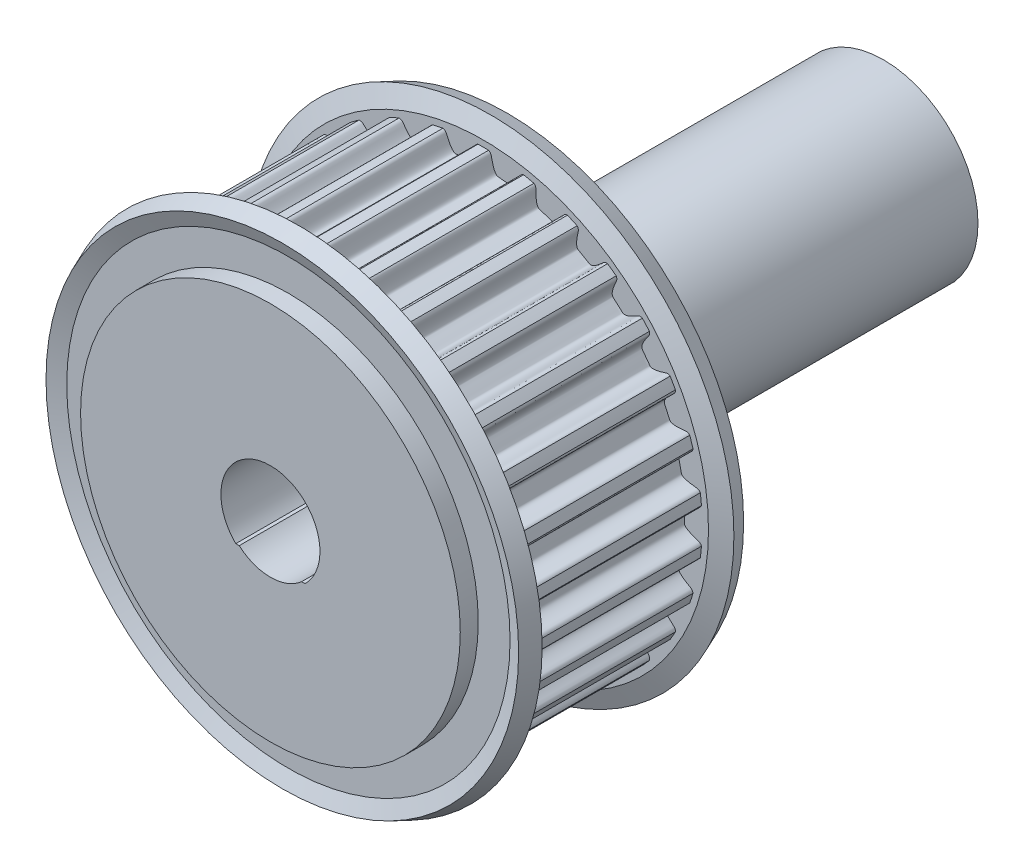
from build123d import *

# Parameters (mm, degrees)
TOOTHEXTRUDECUTGEARBELT01_DEPTH = 3.749999944
TOOTH_PATTERN_30_COUNT          = 30
BOREREVOLVESKETCH_W             = 10.547999842
BOREREVOLVESKETCH_H             = 5
SKETCH_5_R                      = 5
EXTRUDE_1_DEPTH                 = 11
SKETCH_6_R                      = 4
SKETCH_6_R_2                    = 2
EXTRUDE_2_DEPTH                 = 15
CUT_EXTRUDE_4_DEPTH             = 30.810160485
EXTRUDE_START                   = 15
EXTRUDE_4_DEPTH                 = 15
SKETCH_11_R                     = 2
CUT_EXTRUDE_5_DEPTH             = 21.919982509


with BuildPart() as part:
    # SketchRevolveGearBelt01 → Gates_PowerGrip_GT_2mm, 6mm Belt Width (revolve)
    with BuildSketch(Plane(origin=(0, 0, 0), x_dir=(0, 0, -1), z_dir=(1, 0, 0))):
        Polygon((5.273999921, 0), (5.273999921, 8.049296465), (4.511999932, 8.049296465), (4.511999932, 9.39772522), (4.769626867, 10.01969166), (4.065630673, 10.311296431), (3.749999944, 9.549296442), (3.749999944, 9.280480626), (-3.749999944, 9.280480626), (-3.749999944, 9.549296442), (-4.065630673, 10.311296431), (-4.769626867, 10.01969166), (-4.511999932, 9.39772522), (-4.511999932, 8.049296465), (-5.273999921, 8.049296465), (-5.273999921, 0), align=None)
    revolve(axis=Axis((0, 0, 0), (0, 0, -1)))

    # SketchToothGearBelt01 → ToothExtrudeCutGearBelt01 (cut, symmetric)
    with BuildSketch(Plane.XY):
        with BuildLine():
            ThreePointArc((9.259469869, 0.812097889), (9.295013999, 0), (9.259469869, -0.812097889))
            add(Edge.make_bspline(
                [(9.259469869, -0.812097889), (9.259882643, -0.798926426), (9.258535745, -0.779109129), (9.252881928, -0.753334284), (9.246755053, -0.734515852), (9.238801169, -0.716393821), (9.229098, -0.699145002), (9.217740163, -0.682937939), (9.204838756, -0.667930081), (9.190518793, -0.65427062), (9.174923394, -0.642082736), (9.158192233, -0.631523205), (9.140535394, -0.622553924), (9.096806178, -0.606636992), (9.040654354, -0.589254035), (8.974000339, -0.567478509), (8.923234955, -0.549822047), (8.875536871, -0.532182767), (8.830912224, -0.514541632), (8.789358436, -0.496903406), (8.750874778, -0.479266882), (8.715459684, -0.46163211), (8.68311132, -0.443998471), (8.653827322, -0.426364888), (8.627604868, -0.408729361), (8.604440496, -0.39108843), (8.584331378, -0.373436343), (8.567273563, -0.355764081), (8.553273739, -0.338058507), (8.542322401, -0.320303478), (8.534501566, -0.302483729), (8.529637264, -0.284599108), (8.527464323, -0.250294946), (8.531227193, -0.199977901), (8.531655597, -0.133284358), (8.532656984, -0.066646885), (8.532835685, 0), (8.532656984, 0.066646885), (8.531655597, 0.133284358), (8.531227193, 0.199977901), (8.527464323, 0.250294946), (8.529637264, 0.284599108), (8.534501566, 0.302483729), (8.542322401, 0.320303478), (8.553273739, 0.338058507), (8.567273563, 0.355764081), (8.584331378, 0.373436343), (8.604440496, 0.39108843), (8.627604868, 0.408729361), (8.653827322, 0.426364888), (8.68311132, 0.443998471), (8.715459684, 0.46163211), (8.750874778, 0.479266882), (8.789358436, 0.496903406), (8.830912224, 0.514541632), (8.875536871, 0.532182767), (8.923234955, 0.549822047), (8.974000339, 0.567478509), (9.040654354, 0.589254035), (9.096806178, 0.606636992), (9.140535394, 0.622553924), (9.158192233, 0.631523205), (9.174923394, 0.642082736), (9.190518793, 0.65427062), (9.204838756, 0.667930081), (9.217740163, 0.682937939), (9.229098, 0.699145002), (9.238801169, 0.716393821), (9.246755053, 0.734515852), (9.252881928, 0.753334284), (9.258535745, 0.779109129), (9.259882643, 0.798926426), (9.259469869, 0.812097889)],
                knots=[0, 0, 0, 0, 0.015923832, 0.023885748, 0.031847664, 0.039809581, 0.047771497, 0.055733413, 0.063695329, 0.071657245, 0.079619161, 0.087581077, 0.095542993, 0.10350491, 0.143783134, 0.166612007, 0.18826668, 0.208754844, 0.228085578, 0.246269698, 0.263320202, 0.279252862, 0.294087016, 0.307846634, 0.320561765, 0.332270503, 0.343021643, 0.352878214, 0.361921967, 0.370258601, 0.378022746, 0.385380527, 0.392526466, 0.419432991, 0.44628866, 0.47314433, 0.5, 0.52685567, 0.55371134, 0.580567009, 0.607473534, 0.614619473, 0.621977254, 0.629741399, 0.638078033, 0.647121786, 0.656978357, 0.667729497, 0.679438235, 0.692153366, 0.705912984, 0.720747138, 0.736679798, 0.753730302, 0.771914422, 0.791245156, 0.81173332, 0.833387993, 0.856216866, 0.89649509, 0.904457007, 0.912418923, 0.920380839, 0.928342755, 0.936304671, 0.944266587, 0.952228503, 0.960190419, 0.968152336, 0.976114252, 0.984076168, 1, 1, 1, 1], degree=3))
        make_face()
    toothextrudecutgearbelt01 = extrude(amount=TOOTHEXTRUDECUTGEARBELT01_DEPTH, both=True, mode=Mode.SUBTRACT)

    # Tooth Pattern, 30: ToothExtrudeCutGearBelt01 ×30 about axis
    tooth_pattern_30_axis = Axis((0, 0, 55), (0, 0, -1))
    for i in range(1, TOOTH_PATTERN_30_COUNT):
        add(toothextrudecutgearbelt01.rotate(tooth_pattern_30_axis, i * 360 / TOOTH_PATTERN_30_COUNT), mode=Mode.SUBTRACT)

    # BoreRevolveSketch → BoreRevolveCut (revolve, cut)
    with BuildSketch(Plane(origin=(0, 0, 0), x_dir=(0, 0, -1), z_dir=(1, 0, 0))):
        with Locations((0, 2.5)):
            Rectangle(BOREREVOLVESKETCH_W, BOREREVOLVESKETCH_H)
    revolve(axis=Axis((0, 0, 0), (0, 0, -1)), mode=Mode.SUBTRACT)

    # 草图5 → 凸台-拉伸1 (add)
    with BuildSketch(Plane.XY.offset(5.273999921)):
        Circle(SKETCH_5_R)
    extrude(amount=-EXTRUDE_1_DEPTH)

    # 草图6 → 凸台-拉伸2 (add)
    with BuildSketch(Plane(origin=(0, 0, -5.726000079), x_dir=(-1, 0, 0), z_dir=(0, 0, -1))):
        Circle(SKETCH_6_R)
        Circle(SKETCH_6_R_2, mode=Mode.SUBTRACT)
    extrude(amount=EXTRUDE_2_DEPTH)

    # 草图7 → 切除-拉伸4 (cut, through all)
    with BuildSketch(Plane(origin=(0, 0, -20.726000079), x_dir=(-1, 0, 0), z_dir=(0, 0, -1))):
        with BuildLine():
            ThreePointArc((2.1, 0), (-0.8135241, 1.936021317), (-1.469693846, -1.5))
            Line((-1.469693846, -1.5), (-1.322875656, -1.5))
            ThreePointArc((-1.322875656, -1.5), (-0.822875656, 1.822875656), (2, 0))
            ThreePointArc((2, 0), (1.822875656, -0.822875656), (1.322875656, -1.5))
            Line((1.322875656, -1.5), (1.469693846, -1.5))
            ThreePointArc((1.469693846, -1.5), (1.936021317, -0.8135241), (2.1, 0))
        make_face()
    extrude(amount=-CUT_EXTRUDE_4_DEPTH, mode=Mode.SUBTRACT)

    # 草图10 → 凸台-拉伸4 (add)
    with BuildSketch(Plane(origin=(0, 0, -5.726000079), x_dir=(-1, 0, 0), z_dir=(0, 0, -1)).offset(EXTRUDE_START)):
        with BuildLine():
            Line((0, -1.499414808), (-1.323538905, -1.499414808))
            ThreePointArc((-1.323538905, -1.499414808), (-1.323207313, -1.499707441), (-1.322875656, -1.5))
            ThreePointArc((-1.322875656, -1.5), (0, -2), (1.322875656, -1.5))
            ThreePointArc((1.322875656, -1.5), (1.323207313, -1.499707441), (1.323538905, -1.499414808))
            Line((1.323538905, -1.499414808), (0, -1.499414808))
        make_face()
    extrude(amount=-EXTRUDE_4_DEPTH)

    # 草图11 → 切除-拉伸5 (cut, through all)
    with BuildSketch(Plane(origin=(0, 0, -5.726000079), x_dir=(-1, 0, 0), z_dir=(0, 0, -1))):
        Circle(SKETCH_11_R)
    extrude(amount=-CUT_EXTRUDE_5_DEPTH, mode=Mode.SUBTRACT)


solid = part.part
